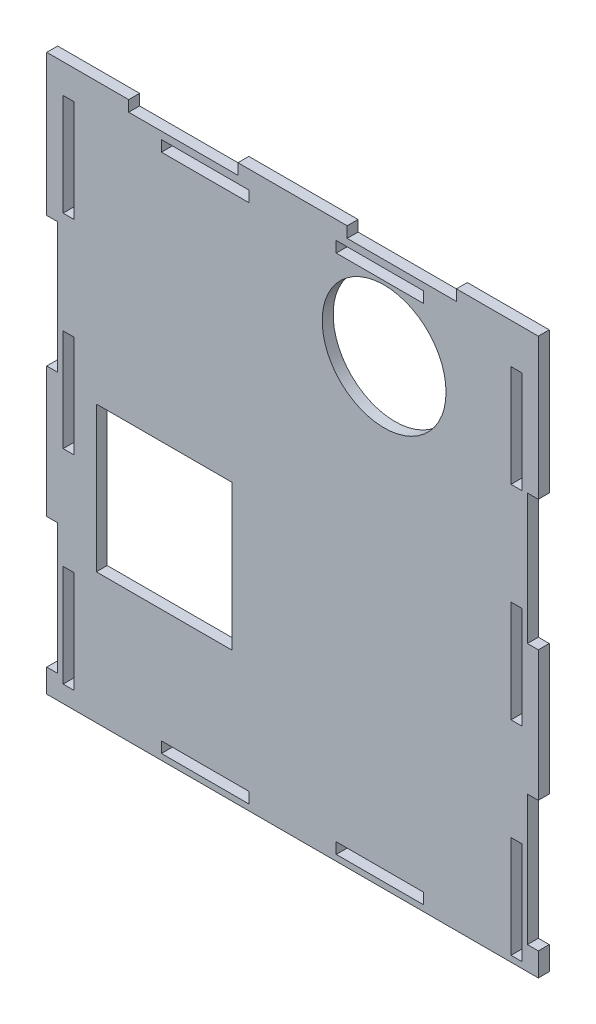
from build123d import *

# Parameters (mm, degrees)
SKETCH1_W           = 3
SKETCH1_H           = 28
SKETCH1_W_2         = 24
SKETCH1_H_2         = 3
SKETCH1_W_3         = 37.21593358
SKETCH1_H_3         = 39.913354034
SKETCH1_R           = 17
BOSS_EXTRUDE1_DEPTH = 3


with BuildPart() as part:
    # Sketch1 → Boss-Extrude1 (new body)
    with BuildSketch(Plane.XY):
        Polygon((-3, 0), (0, 0), (129, 0), (132, 0), (132, 6.45), (129, 6.45), (129, 42.25), (132, 42.25), (132, 78.05), (129, 78.05), (129, 113.85), (132, 113.85), (132, 149.65), (132, 152.65), (129, 152.65), (109.5, 152.65), (109.5, 149.65), (79.5, 149.65), (79.5, 152.65), (49.5, 152.65), (49.5, 149.65), (19.5, 149.65), (19.5, 152.65), (0, 152.65), (-3, 152.65), (-3, 149.65), (-3, 113.85), (0, 113.85), (0, 78.05), (-3, 78.05), (-3, 42.25), (0, 42.25), (0, 6.45), (-3, 6.45), align=None)
        with Locations((3, 18.65)):
            Rectangle(SKETCH1_W, SKETCH1_H, mode=Mode.SUBTRACT)
        with Locations((40.5, 3.15)):
            Rectangle(SKETCH1_W_2, SKETCH1_H_2, mode=Mode.SUBTRACT)
        with Locations((29.221504117, 55.860198814)):
            Rectangle(SKETCH1_W_3, SKETCH1_H_3, mode=Mode.SUBTRACT)
        with Locations((3, 74.65)):
            Rectangle(SKETCH1_W, SKETCH1_H, mode=Mode.SUBTRACT)
        with Locations((88.5, 3.15)):
            Rectangle(SKETCH1_W_2, SKETCH1_H_2, mode=Mode.SUBTRACT)
        with Locations((126, 15.65)):
            Rectangle(SKETCH1_W, SKETCH1_H, mode=Mode.SUBTRACT)
        with Locations((126, 71.65)):
            Rectangle(SKETCH1_W, SKETCH1_H, mode=Mode.SUBTRACT)
        with Locations((3, 130.65)):
            Rectangle(SKETCH1_W, SKETCH1_H, mode=Mode.SUBTRACT)
        with Locations((40.5, 146.15)):
            Rectangle(SKETCH1_W_2, SKETCH1_H_2, mode=Mode.SUBTRACT)
        with Locations((89.65, 126.65)):
            Circle(SKETCH1_R, mode=Mode.SUBTRACT)
        with Locations((88.5, 146.15)):
            Rectangle(SKETCH1_W_2, SKETCH1_H_2, mode=Mode.SUBTRACT)
        with Locations((126, 127.65)):
            Rectangle(SKETCH1_W, SKETCH1_H, mode=Mode.SUBTRACT)
    extrude(amount=BOSS_EXTRUDE1_DEPTH)


solid = part.part
